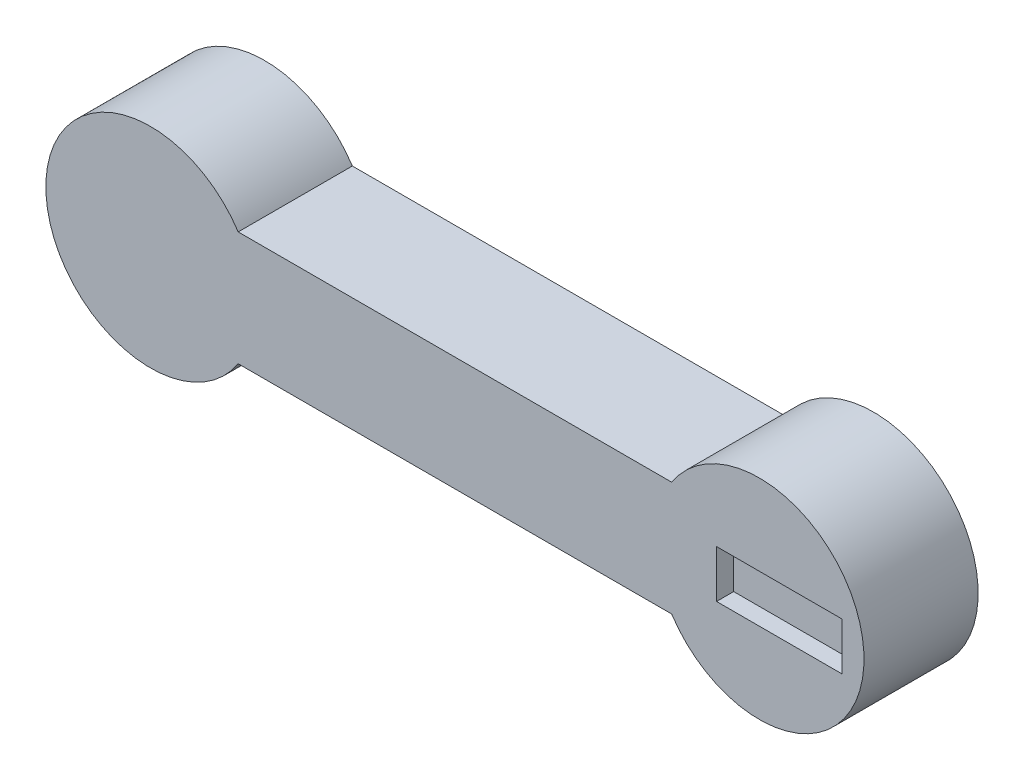
from build123d import *

# Parameters (mm, degrees)
BOSS_EXTRUDE1_DEPTH = 30
SKETCH2_W           = 33
SKETCH2_H           = 12.5
CUT_EXTRUDE1_DEPTH  = 4.5


with BuildPart() as part:
    # Sketch1 → Boss-Extrude1 (new body)
    with BuildSketch(Plane.XY):
        with BuildLine():
            ThreePointArc((23.048861143, 15), (-27.5, 0), (23.048861143, -15))
            Line((23.048861143, -15), (136.951138857, -15))
            ThreePointArc((136.951138857, -15), (187.5, 0), (136.951138857, 15))
            Line((136.951138857, 15), (23.048861143, 15))
        make_face()
    extrude(amount=BOSS_EXTRUDE1_DEPTH)

    # Sketch2 → Cut-Extrude1 (cut)
    with BuildSketch(Plane.XY.offset(30)):
        with Locations((165.25, 0)):
            Rectangle(SKETCH2_W, SKETCH2_H)
    extrude(amount=-CUT_EXTRUDE1_DEPTH, mode=Mode.SUBTRACT)


solid = part.part
